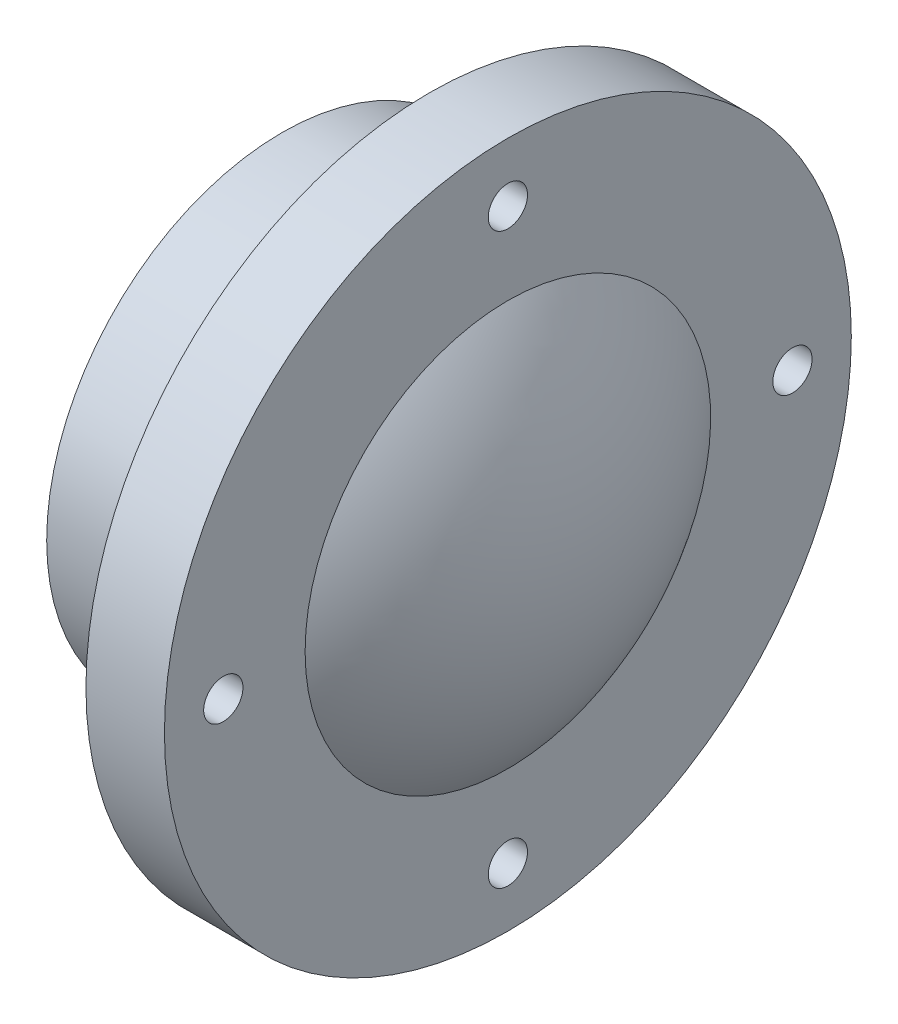
from build123d import *


# Read off the part's stored shape, not the designer's step: Ø4.0mm 暗销孔1
with BuildPart() as part:
    # 草图1 → 旋转1 (revolve)
    with BuildSketch(Plane.XY, mode=Mode.PRIVATE) as revolve_1_sk:
        with BuildLine():
            Line((0, 17.25), (0, 24))
            Line((0, 24), (15, 24))
            Line((15, 24), (15, 35))
            Line((15, 35), (23, 35))
            Line((23, 35), (23, 20.66397832))
            ThreePointArc((23, 20.66397832), (28.202484376, 10.908712115), (30, 0))
            Line((30, 0), (24, 0))
            ThreePointArc((24, 0), (22.472147517, 9.122795944), (18.055328154, 17.25))
            Line((18.055328154, 17.25), (0, 17.25))
        make_face()
    revolve(revolve_1_sk.sketch.rotate(Axis((0, 0, 0), (1, 0, 0)), 90), axis=Axis((0, 0, 0), (1, 0, 0)))

    # Ø4.0mm 暗销孔1 outline → Ø4.0mm 暗销孔1 (revolve, cut)
    with BuildSketch(Plane(origin=(0, 29, 0), x_dir=(0, 1, 0), z_dir=(0, 0, -1))):
        Polygon((0, 23), (0, 18), (2, 19.201721238), (2, 23), align=None)
    revolve(axis=Axis((0, 29, 0), (1, 0, 0)), mode=Mode.SUBTRACT)

    # 4.0mm _1 2 outline → 4.0mm _1 2 (revolve, cut)
    with BuildSketch(Plane.YX.offset(-29)):
        Polygon((0, 23), (0, 18), (2, 19.201721238), (2, 23), align=None)
    revolve(axis=Axis((0, 0, 29), (1, 0, 0)), mode=Mode.SUBTRACT)

    # 4.0mm _1 3 outline → 4.0mm _1 3 (revolve, cut)
    with BuildSketch(Plane(origin=(0, -29, 0), x_dir=(0, 1, 0), z_dir=(0, 0, -1))):
        Polygon((0, 23), (0, 18), (2, 19.201721238), (2, 23), align=None)
    revolve(axis=Axis((0, -29, 0), (1, 0, 0)), mode=Mode.SUBTRACT)

    # 4.0mm _1 4 outline → 4.0mm _1 4 (revolve, cut)
    with BuildSketch(Plane.YX.offset(29)):
        Polygon((0, 23), (0, 18), (2, 19.201721238), (2, 23), align=None)
    revolve(axis=Axis((0, 0, -29), (1, 0, 0)), mode=Mode.SUBTRACT)


solid = part.part
